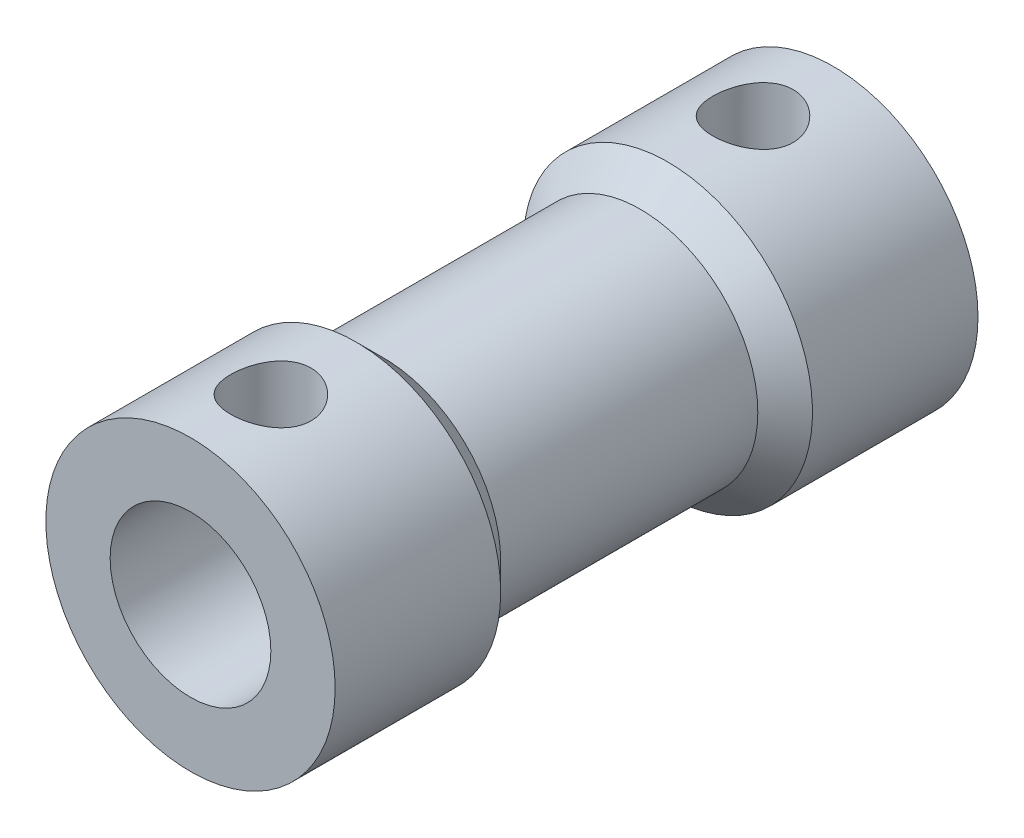
from build123d import *

# Parameters (mm, degrees)
SKETCH_1_R                = 4.5
EXTRUDE_1_DEPTH           = 5
SKETCH_2_R                = 3.65
EXTRUDE_2_DEPTH           = 10
SKETCH_3_R                = 4.5
EXTRUDE_3_DEPTH           = 5
CHAMFER_2_SIZE            = 1
CHAMFER_3_SIZE            = 1
HOLE_WIZARD_5_0_5_1_D     = 5
HOLE_WIZARD_5_0_5_1_DEPTH = 5
HOLE_WIZARD_5_0_5_1_TIP   = 1.502151548
HOLE_WIZARD_3_0_3_1_D     = 3
HOLE_WIZARD_3_0_3_1_DEPTH = 5
HOLE_WIZARD_3_0_3_1_TIP   = 0.901290929
M3X0_5_1_REACH            = 24.389
M3X0_5_1_BORE_R           = 1.25


with BuildPart() as part:
    # 草圖1 → 填料-伸長1 (new body)
    with BuildSketch(Plane.XY):
        Circle(SKETCH_1_R)
    extrude(amount=EXTRUDE_1_DEPTH)

    # 草圖2 → 填料-伸長2 (add)
    with BuildSketch(Plane.XY.offset(5)):
        Circle(SKETCH_2_R)
    extrude(amount=EXTRUDE_2_DEPTH)

    # 草圖3 → 填料-伸長3 (add)
    with BuildSketch(Plane.XY.offset(15)):
        Circle(SKETCH_3_R)
    extrude(amount=EXTRUDE_3_DEPTH)

    # 導角2
    # the kernel refuses this chamfer: 1 mm, written as the material it adds along each edge
    with BuildSketch(Plane(origin=(0, 0, 5), x_dir=(1, 0, 0), z_dir=(0, -1, 0))) as chamfer_2_piece_1_section:
        Polygon((3.65, CHAMFER_2_SIZE), (3.65 + CHAMFER_2_SIZE, 0), (3.65, 0), align=None)
    chamfer_2_piece_1 = revolve(axis=Axis((0, 0, 5), (0, 0, 1)), mode=Mode.PRIVATE)
    chamfer_2_piece_1 = chamfer_2_piece_1 & Plane(origin=(0, 0, 5.572415942), x_dir=(1, 0, 0), z_dir=(0, 0, -1)) * Cylinder(4.5, 19, mode=Mode.PRIVATE)
    add(chamfer_2_piece_1)

    # 導角3
    # the kernel refuses this chamfer: 1 mm, written as the material it adds along each edge
    with BuildSketch(Plane(origin=(0, 0, 15), x_dir=(1, 0, 0), z_dir=(0, -1, 0))) as chamfer_3_piece_1_section:
        Polygon((3.65, -CHAMFER_3_SIZE), (3.65 + CHAMFER_3_SIZE, 0), (3.65, 0), align=None)
    chamfer_3_piece_1 = revolve(axis=Axis((0, 0, 15), (0, 0, 1)), mode=Mode.PRIVATE)
    chamfer_3_piece_1 = chamfer_3_piece_1 & Plane(origin=(0, 0, 14.427584058), x_dir=(1, 0, 0), z_dir=(0, 0, -1)) * Cylinder(4.5, 19, mode=Mode.PRIVATE)
    add(chamfer_3_piece_1)

    # Ø5.0 (5) 直徑孔1
    with Locations(Plane.XY.offset(20)):
        with Locations((0, 0)):
            Hole(HOLE_WIZARD_5_0_5_1_D / 2, depth=HOLE_WIZARD_5_0_5_1_DEPTH)
            with Locations((0, 0, -(HOLE_WIZARD_5_0_5_1_DEPTH + HOLE_WIZARD_5_0_5_1_TIP / 2))):  # 118° drill point
                Cone(0, HOLE_WIZARD_5_0_5_1_D / 2, HOLE_WIZARD_5_0_5_1_TIP, mode=Mode.SUBTRACT)

    # Ø3.0 (3) 直徑孔1
    with Locations(Plane(origin=(0, 0, 0), x_dir=(-1, 0, 0), z_dir=(0, 0, -1))):
        with Locations((0, 0)):
            Hole(HOLE_WIZARD_3_0_3_1_D / 2, depth=HOLE_WIZARD_3_0_3_1_DEPTH)
            with Locations((0, 0, -(HOLE_WIZARD_3_0_3_1_DEPTH + HOLE_WIZARD_3_0_3_1_TIP / 2))):  # 118° drill point
                Cone(0, HOLE_WIZARD_3_0_3_1_D / 2, HOLE_WIZARD_3_0_3_1_TIP, mode=Mode.SUBTRACT)

    # M3x0.5  螺絲攻的螺孔鑽1 bore → M3x0.5  螺絲攻的螺孔鑽1 (cut, up to next)
    with BuildSketch(Plane(origin=(0, 4.5, 0), x_dir=(1, 0, 0), z_dir=(0, 1, 0)), mode=Mode.PRIVATE) as m3x0_5_1_sk1:
        with Locations((0, -2.5)):
            Circle(M3X0_5_1_BORE_R)
    m3x0_5_1_tool1 = extrude(m3x0_5_1_sk1.sketch, amount=-M3X0_5_1_REACH, mode=Mode.PRIVATE) & part.part
    m3x0_5_1 = m3x0_5_1_tool1.solids().sort_by_distance((0, 4.5, 2.5))[0]
    add(m3x0_5_1, mode=Mode.SUBTRACT)

    # 鏡射1: M3x0.5  螺絲攻的螺孔鑽1 across plane
    add(m3x0_5_1.mirror(Plane(origin=(0, 0, 10), x_dir=(1, 0, 0), z_dir=(0, 0, -1))), mode=Mode.SUBTRACT)


solid = part.part
